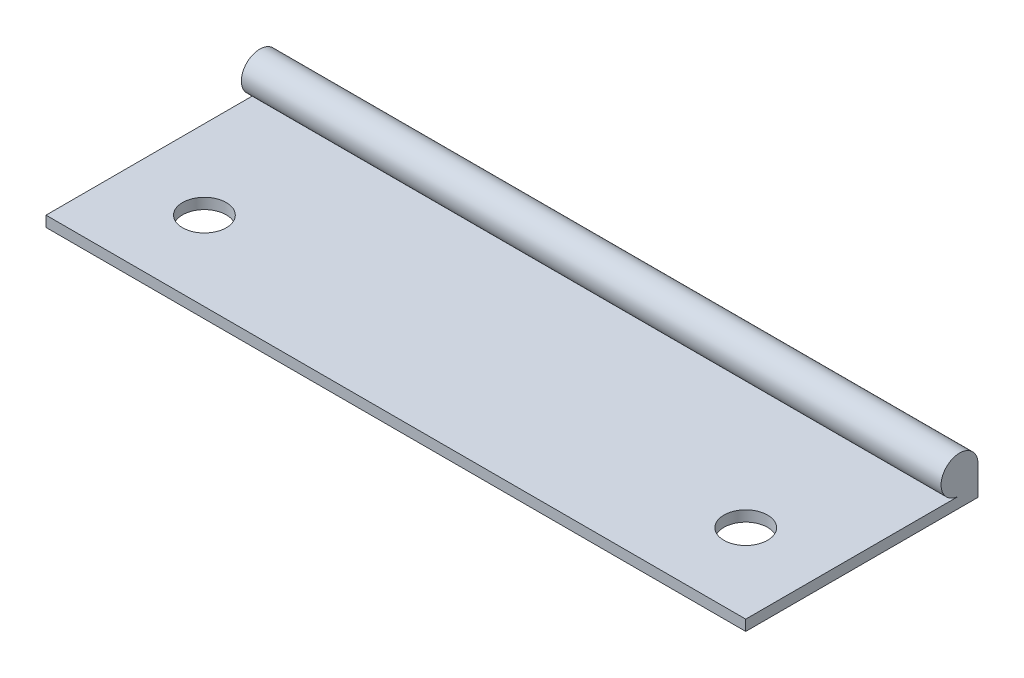
from build123d import *

# Parameters (mm, degrees)
EXTRUDE_1_DEPTH     = 72
SKETCH_2_R          = 2.25
CUT_EXTRUDE_1_DEPTH = 76.958212196


with BuildPart() as part:
    # 草图1 → 凸台-拉伸1 (new body)
    with BuildSketch(Plane(origin=(0, 0, 0), x_dir=(0, 0, -1), z_dir=(1, 0, 0))):
        with BuildLine():
            Line((0, 1.1), (0, 0))
            Line((0, 0), (23.9, 0))
            Line((23.9, 0), (23.9, 3))
            ThreePointArc((23.9, 3), (20.656497116, 4.343502884), (22, 1.1))
            Line((22, 1.1), (0, 1.1))
        make_face()
    extrude(amount=EXTRUDE_1_DEPTH)

    # 草图2 → 切除-拉伸1 (cut, through all)
    with BuildSketch(Plane(origin=(0, 1.1, 0), x_dir=(1, 0, 0), z_dir=(0, 1, 0))):
        with Locations((8.15, 8.15)):
            Circle(SKETCH_2_R)
        with Locations((63.85, 8.15)):
            Circle(SKETCH_2_R)
    extrude(amount=-CUT_EXTRUDE_1_DEPTH, mode=Mode.SUBTRACT)


solid = part.part
